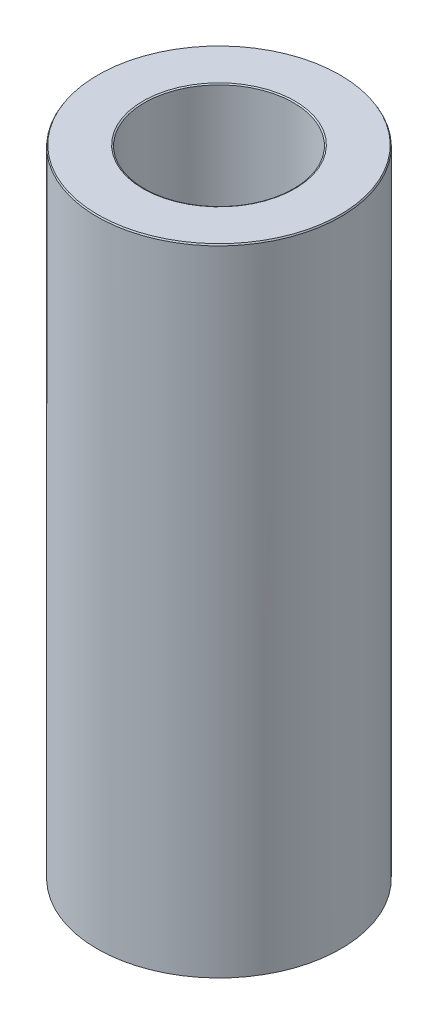
from build123d import *
from OCP.BRepFilletAPI import BRepFilletAPI_MakeChamfer

# Parameters (mm, degrees)
SKETCH1_R           = 57.5
BOSS_EXTRUDE1_DEPTH = 300.156189151
SKETCH2_R           = 35.18825443
CUT_EXTRUDE1_DEPTH  = 311.976265792
CHAMFER1_SIZE       = 0.64997428
CHAMFER1_SIZE2      = 0.375262825


with BuildPart() as part:
    # Sketch1 → Boss-Extrude1 (new body)
    with BuildSketch(Plane(origin=(0, 0, 0), x_dir=(1, 0, 0), z_dir=(0, 1, 0))):
        Circle(SKETCH1_R)
    extrude(amount=BOSS_EXTRUDE1_DEPTH)

    # Sketch2 → Cut-Extrude1 (cut, through all)
    with BuildSketch(Plane(origin=(0, 0, 0), x_dir=(1, 0, 0), z_dir=(0, 1, 0))):
        Circle(SKETCH2_R)
    extrude(amount=CUT_EXTRUDE1_DEPTH, mode=Mode.SUBTRACT)

    # Chamfer1: one chamfer whose edges measure the first distance from different faces: ONE call of the kernel's chamfer builder (chamfer() names one face for all edges)
    chamfer1_edges_1 = [part.edges().sort_by_distance(p)[0] for p in [
        (-35.18825443, 300.156189151, 0),
    ]]
    chamfer1_side_1 = [part.faces().sort_by_distance(p)[0] for p in [
        (-55.873654403, 300.156189151, 0),
    ]]
    chamfer1_edges_2 = [part.edges().sort_by_distance(p)[0] for p in [
        (-35.18825443, 0, 0),
    ]]
    chamfer1_side_2 = [part.faces().sort_by_distance(p)[0] for p in [
        (-35.18825443, 150.078094575, 0),
    ]]
    chamfer1_edges_3 = [part.edges().sort_by_distance(p)[0] for p in [
        (-57.5, 0, 0),
    ]]
    chamfer1_side_3 = [part.faces().sort_by_distance(p)[0] for p in [
        (-55.873654403, 0, 0),
    ]]
    chamfer1_edges_4 = [part.edges().sort_by_distance(p)[0] for p in [
        (-57.5, 300.156189151, 0),
    ]]
    chamfer1_side_4 = [part.faces().sort_by_distance(p)[0] for p in [
        (-57.5, 150.078094575, 0),
    ]]
    chamfer1 = BRepFilletAPI_MakeChamfer(part.part.solid().wrapped)
    for e in chamfer1_edges_1:
        chamfer1.Add(CHAMFER1_SIZE, CHAMFER1_SIZE2, e.wrapped, chamfer1_side_1[0].wrapped)  # the first distance lies on this face
    for e in chamfer1_edges_2:
        chamfer1.Add(CHAMFER1_SIZE, CHAMFER1_SIZE2, e.wrapped, chamfer1_side_2[0].wrapped)  # the first distance lies on this face
    for e in chamfer1_edges_3:
        chamfer1.Add(CHAMFER1_SIZE, CHAMFER1_SIZE2, e.wrapped, chamfer1_side_3[0].wrapped)  # the first distance lies on this face
    for e in chamfer1_edges_4:
        chamfer1.Add(CHAMFER1_SIZE, CHAMFER1_SIZE2, e.wrapped, chamfer1_side_4[0].wrapped)  # the first distance lies on this face
    add(Compound.cast(chamfer1.Shape()), mode=Mode.REPLACE)


solid = part.part
